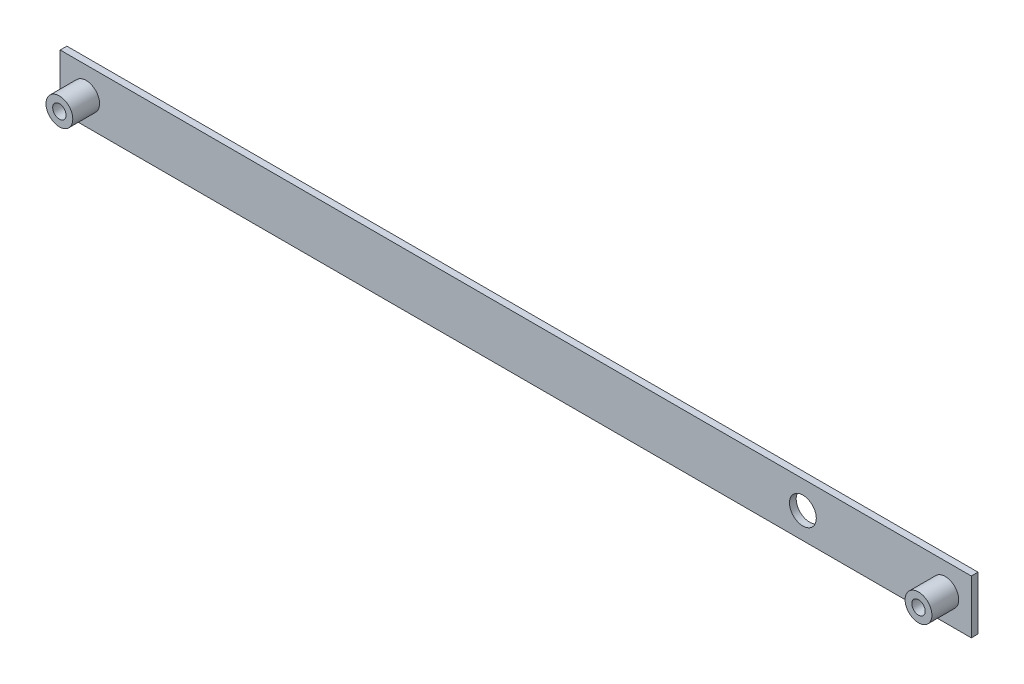
from build123d import *

# Parameters (mm, degrees)
SKETCH1_W           = 431.8
SKETCH1_H           = 25.4
SKETCH1_R           = 3.175
BOSS_EXTRUDE1_DEPTH = 3.175
SKETCH2_R           = 6.35
SKETCH2_R_2         = 3.175
BOSS_EXTRUDE2_DEPTH = 12.7
CUT_EXTRUDE1_REACH  = 421.865
SKETCH3_R           = 6.35


with BuildPart() as part:
    # Sketch1 → Boss-Extrude1 (new body)
    with BuildSketch(Plane.XY):
        with Locations((203.581, 0)):
            Rectangle(SKETCH1_W, SKETCH1_H)
        Circle(SKETCH1_R, mode=Mode.SUBTRACT)
        with Locations((407.162, 0)):
            Circle(SKETCH1_R, mode=Mode.SUBTRACT)
    extrude(amount=BOSS_EXTRUDE1_DEPTH)

    # Sketch2 → Boss-Extrude2 (add)
    # profile 1 of 2: a face of its own
    with BuildSketch(Plane.XY.offset(3.175)):
        Circle(SKETCH2_R)
        Circle(SKETCH2_R_2, mode=Mode.SUBTRACT)
    # profile 2 of 2: a face of its own
    with BuildSketch(Plane.XY.offset(3.175)):
        with Locations((407.162, 0)):
            Circle(SKETCH2_R)
        with Locations((407.162, 0)):
            Circle(SKETCH2_R_2, mode=Mode.SUBTRACT)
    extrude(amount=BOSS_EXTRUDE2_DEPTH)

    # Sketch3 → Cut-Extrude1 (cut, up to next)
    with BuildSketch(Plane.XY.offset(3.175), mode=Mode.PRIVATE) as cut_extrude1_sk1:
        with Locations((339.668299959, -0.339967612)):
            Circle(SKETCH3_R)
    cut_extrude1_tool1 = extrude(cut_extrude1_sk1.sketch, amount=-CUT_EXTRUDE1_REACH, mode=Mode.PRIVATE) & part.part
    add(cut_extrude1_tool1.solids().sort_by_distance((339.6683, -0.339968, 3.175))[0], mode=Mode.SUBTRACT)


solid = part.part
